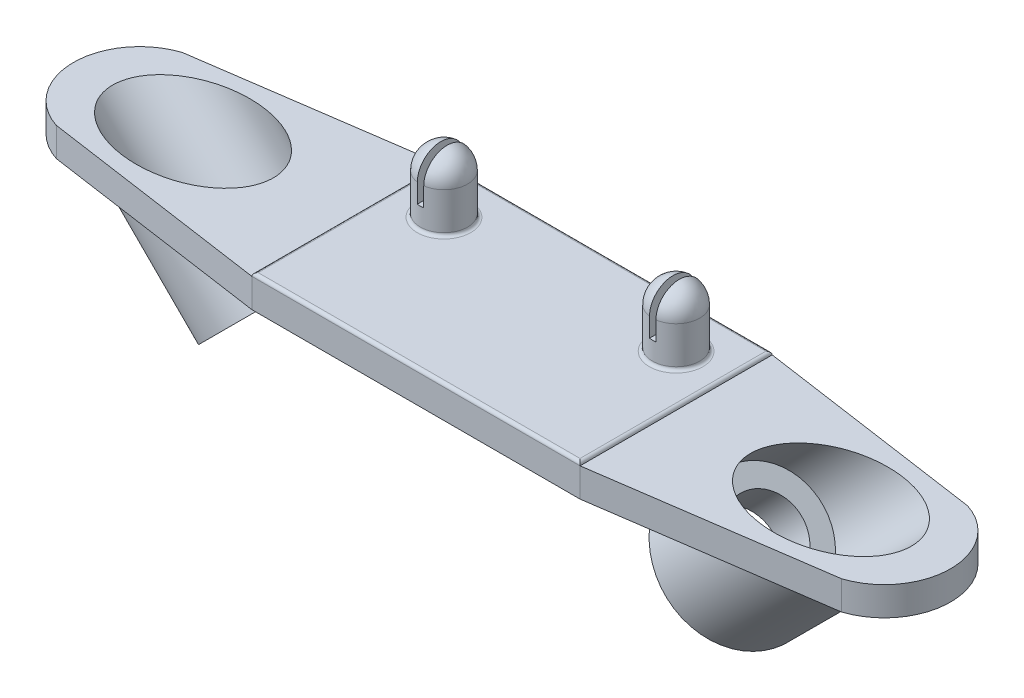
from build123d import *

# Parameters (mm, degrees)
SKETCH1_W           = 20.5
SKETCH1_H           = 12
BOSS_EXTRUDE2_DEPTH = 2
SKETCH2_R           = 1.475
BOSS_EXTRUDE3_DEPTH = 4
FILLET1_R           = 1.475
FILLET2_R           = 0.2
BOSS_EXTRUDE4_DEPTH = 1.8
SKETCH6_R           = 2.25
CUT_EXTRUDE1_DEPTH  = 36.148325783
SKETCH7_W           = 18.806014856
SKETCH7_H           = 6.487022836
CUT_EXTRUDE2_DEPTH  = 29.955928605
SKETCH14_R          = 3.55
CUT_EXTRUDE4_DEPTH  = 8
CUT_EXTRUDE5_START  = -6
CUT_EXTRUDE5_DEPTH  = 6
SKETCH15_W          = 0.4
SKETCH15_H          = 2.666666667
CUT_EXTRUDE6_DEPTH  = 31.764359271


with BuildPart() as part:
    # Sketch1 → Boss-Extrude2 (new body)
    with BuildSketch(Plane(origin=(0, 0, 0), x_dir=(1, 0, 0), z_dir=(0, 1, 0))):
        Rectangle(SKETCH1_W, SKETCH1_H)
    extrude(amount=BOSS_EXTRUDE2_DEPTH)

    # Sketch2 → Boss-Extrude3 (add)
    with BuildSketch(Plane(origin=(0, 2, 0), x_dir=(1, 0, 0), z_dir=(0, 1, 0))):
        with Locations((-7.25, 3)):
            Circle(SKETCH2_R)
        with Locations((7.25, 3)):
            Circle(SKETCH2_R)
    extrude(amount=BOSS_EXTRUDE3_DEPTH)

    # Fillet1
    fillet1_edges = [part.edges().sort_by_distance(p)[0] for p in [
        (5.775, 6, -3),
        (-8.725, 6, -3),
    ]]
    fillet(fillet1_edges, radius=FILLET1_R)

    # Fillet2
    fillet2_edges = [part.edges().sort_by_distance(p)[0] for p in [
        (0, 2, 6),
        (-10.25, 2, 0),
        (0, 2, -6),
        (10.25, 2, 0),
        (-8.725, 2, -3),
        (5.775, 2, -3),
    ]]
    fillet(fillet2_edges, radius=FILLET2_R)

    # Sketch3 → Boss-Extrude4 (add)
    with BuildSketch(Plane.XZ):
        with BuildLine():
            Line((10.25, -6), (24.517982167, -3.939264487))
            ThreePointArc((24.517982167, -3.939264487), (27.388306837, 0), (24.517982167, 3.939264487))
            Line((24.517982167, 3.939264487), (10.25, 6))
            Line((10.25, 6), (10.25, 0))
            Line((10.25, 0), (10.25, -6))
        make_face()
    boss_extrude4 = extrude(amount=-BOSS_EXTRUDE4_DEPTH)

    # Mirror1: Boss-Extrude4 across plane
    add(boss_extrude4.mirror(Plane(origin=(0, 0, 0), x_dir=(0, 0, 1), z_dir=(1, 0, 0))))

    # Sketch4 → Revolve2 (revolve)
    with BuildSketch(Plane.XY):
        Polygon((14.068278144, -4.051721856), (17.250258659, -7.233702372), (24.483961031, 0), (18.12, 0), align=None)
    revolve2 = revolve(axis=Axis((18.12, 0, 0), (-0.7071067811865459, -0.7071067811865492, 0)))

    # Mirror2: Revolve2 across plane
    add(revolve2.mirror(Plane(origin=(0, 0, 0), x_dir=(0, 0, 1), z_dir=(1, 0, 0))))

    # Sketch6 → Cut-Extrude1 (cut, symmetric)
    with BuildSketch(Plane(origin=(5.008278144, 5.008278144, 0), x_dir=(0, 0, 1), z_dir=(-0.707106781186546, -0.707106781186549, 0))):
        with Locations((0, -12.812774875)):
            Circle(SKETCH6_R)
    cut_extrude1 = extrude(amount=CUT_EXTRUDE1_DEPTH, both=True, mode=Mode.SUBTRACT)

    # Mirror3: Cut-Extrude1 across plane
    add(cut_extrude1.mirror(Plane(origin=(0, 0, 0), x_dir=(0, 0, 1), z_dir=(1, 0, 0))), mode=Mode.SUBTRACT)

    # Sketch7 → Cut-Extrude2 (cut, symmetric)
    with BuildSketch(Plane.XY):
        with Locations((19.653007428, 5.043511418)):
            Rectangle(SKETCH7_W, SKETCH7_H)
    cut_extrude2 = extrude(amount=CUT_EXTRUDE2_DEPTH, both=True, mode=Mode.SUBTRACT)

    # Mirror4: Cut-Extrude2 across plane
    add(cut_extrude2.mirror(Plane(origin=(0, 0, 0), x_dir=(0, 0, 1), z_dir=(1, 0, 0))), mode=Mode.SUBTRACT)

    # Sketch14 → Cut-Extrude4 (cut)
    with BuildSketch(Plane(origin=(-12.450990258, 12.450990258, 0), x_dir=(0, 0, -1), z_dir=(0.7071067811865438, -0.7071067811865512, 0))):
        with Locations((0, -12.812774875)):
            Circle(SKETCH14_R)
    cut_extrude4 = extrude(amount=CUT_EXTRUDE4_DEPTH, mode=Mode.SUBTRACT)

    # Sketch14 → Cut-Extrude5 (cut)
    with BuildSketch(Plane(origin=(-12.450990258, 12.450990258, 0), x_dir=(0, 0, -1), z_dir=(0.7071067811865438, -0.7071067811865512, 0)).offset(CUT_EXTRUDE5_START)):
        with Locations((0, -12.812774875)):
            Circle(SKETCH14_R)
    cut_extrude5 = extrude(amount=CUT_EXTRUDE5_DEPTH, mode=Mode.SUBTRACT)

    # Mirror5: Cut-Extrude4, Cut-Extrude5 across plane
    add(cut_extrude4.mirror(Plane(origin=(0, 0, 0), x_dir=(0, 0, 1), z_dir=(1, 0, 0))), mode=Mode.SUBTRACT)
    add(cut_extrude5.mirror(Plane(origin=(0, 0, 0), x_dir=(0, 0, 1), z_dir=(1, 0, 0))), mode=Mode.SUBTRACT)

    # Sketch15 → Cut-Extrude6 (cut, symmetric)
    with BuildSketch(Plane.XY.offset(6)):
        with Locations((-7.25, 4.666666667)):
            Rectangle(SKETCH15_W, SKETCH15_H)
    cut_extrude6 = extrude(amount=CUT_EXTRUDE6_DEPTH, both=True, mode=Mode.SUBTRACT)

    # Mirror6: Cut-Extrude6 across plane
    add(cut_extrude6.mirror(Plane(origin=(0, 0, 0), x_dir=(0, 0, 1), z_dir=(1, 0, 0))), mode=Mode.SUBTRACT)


solid = part.part
